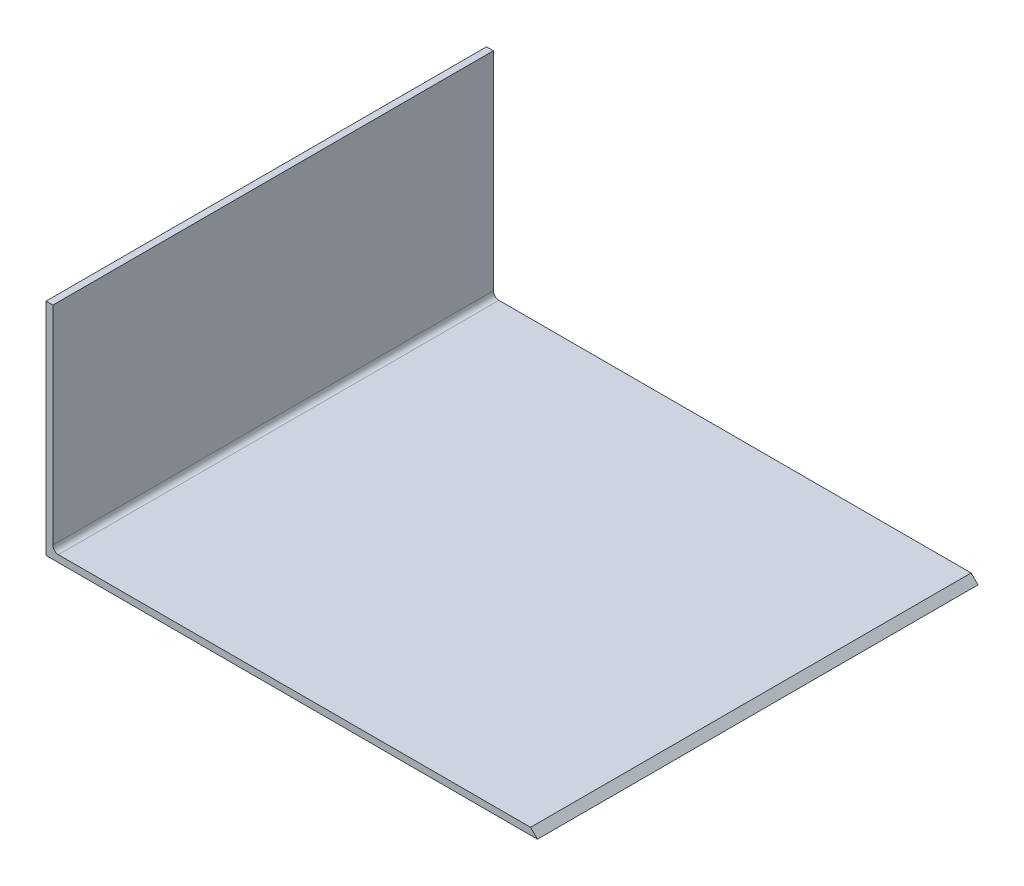
from build123d import *

# Parameters (mm, degrees)
SKETCH1_W           = 3.175
SKETCH1_H           = 98.425
BOSS_EXTRUDE1_DEPTH = 101.6
CHAMFER1_SIZE       = 5.08


with BuildPart() as part:
    # Sketch1 → Boss-Extrude1 (new, symmetric)
    with BuildSketch(Plane.XY):
        Polygon((3.175, 0), (0, 0), (0, -3.175), (228.6, -3.175), (228.6, 0), (5.715, 0), align=None)
        with Locations((1.5875, 49.2125)):
            Rectangle(SKETCH1_W, SKETCH1_H)
        with BuildLine():
            Line((3.175, 2.54), (3.175, 0))
            Line((3.175, 0), (5.715, 0))
            ThreePointArc((5.715, 0), (3.918948776, 0.743948776), (3.175, 2.54))
        make_face()
    extrude(amount=BOSS_EXTRUDE1_DEPTH, both=True)

    # Chamfer1
    # the kernel refuses this chamfer: 5.08 mm, written as the material it takes off along each edge
    with BuildSketch(Plane(origin=(228.6, 0, 114.664149579), x_dir=(-0.9996219169112968, 0.027495876610586324, 0), z_dir=(0, 0, -1))) as chamfer1_piece_1:
        Polygon((CHAMFER1_SIZE * 0.999621916911, -CHAMFER1_SIZE * 0.0274958766106), (-CHAMFER1_SIZE * 0.0274958766106, -CHAMFER1_SIZE * 0.999621916911), (0, 0), align=None)
    extrude(amount=229.328299158, mode=Mode.SUBTRACT)


solid = part.part
